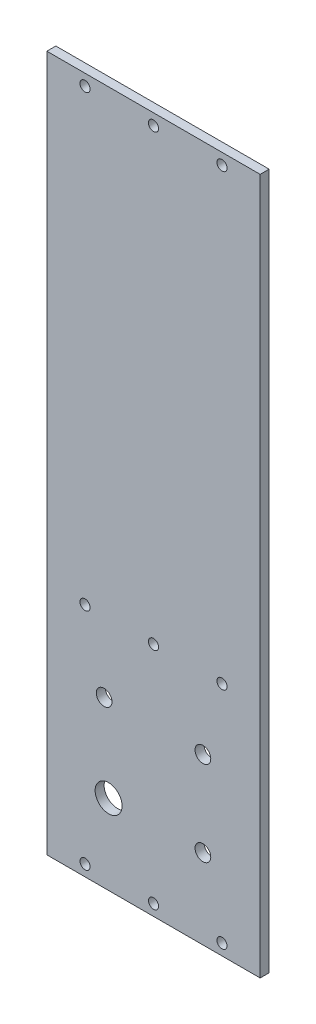
from build123d import *

# Parameters (mm, degrees)
SCHIZZO1_W                   = 95
SCHIZZO1_H                   = 310
SCHIZZO1_R                   = 2.25
SCHIZZO1_R_2                 = 3.5
SCHIZZO1_R_3                 = 6
ESTRUSIONE_ESTRUSIONE1_DEPTH = 4


with BuildPart() as part:
    # Schizzo1 → Estrusione-Estrusione1 (new body)
    with BuildSketch(Plane.XY):
        with Locations((47.5, 155)):
            Rectangle(SCHIZZO1_W, SCHIZZO1_H)
        with Locations((78, 5)):
            Circle(SCHIZZO1_R, mode=Mode.SUBTRACT)
        with Locations((47.5, 5)):
            Circle(SCHIZZO1_R, mode=Mode.SUBTRACT)
        with Locations((17, 5)):
            Circle(SCHIZZO1_R, mode=Mode.SUBTRACT)
        with Locations((17, 305)):
            Circle(SCHIZZO1_R, mode=Mode.SUBTRACT)
        with Locations((47.5, 305)):
            Circle(SCHIZZO1_R, mode=Mode.SUBTRACT)
        with Locations((78, 305)):
            Circle(SCHIZZO1_R, mode=Mode.SUBTRACT)
        with Locations((69.5, 35.6)):
            Circle(SCHIZZO1_R_2, mode=Mode.SUBTRACT)
        with Locations((27.5, 35.6)):
            Circle(SCHIZZO1_R_3, mode=Mode.SUBTRACT)
        with Locations((25.5, 73.5)):
            Circle(SCHIZZO1_R_2, mode=Mode.SUBTRACT)
        with Locations((69.5, 73.5)):
            Circle(SCHIZZO1_R_2, mode=Mode.SUBTRACT)
        with Locations((47.5, 105)):
            Circle(SCHIZZO1_R, mode=Mode.SUBTRACT)
        with Locations((78, 105)):
            Circle(SCHIZZO1_R, mode=Mode.SUBTRACT)
        with Locations((17, 105)):
            Circle(SCHIZZO1_R, mode=Mode.SUBTRACT)
    extrude(amount=-ESTRUSIONE_ESTRUSIONE1_DEPTH)


solid = part.part
